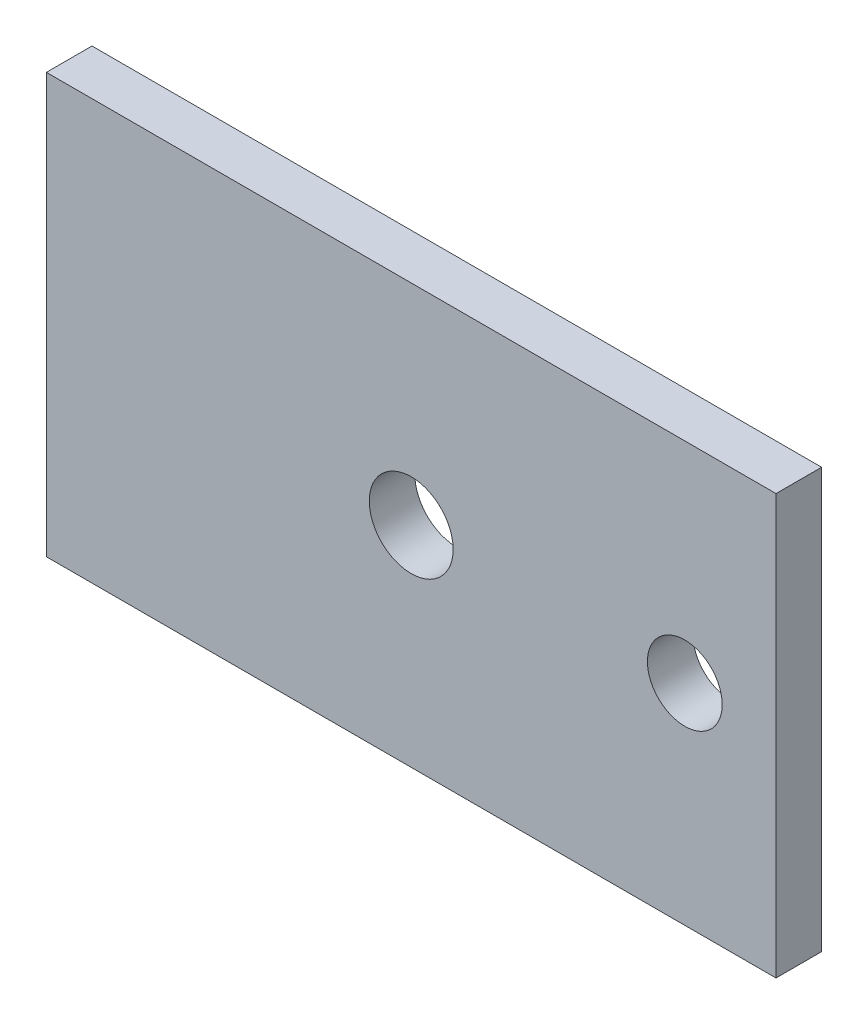
from build123d import *

# Parameters (mm, degrees)
SKETCH1_W           = 80
SKETCH1_H           = 46
SKETCH1_R           = 4.6
SKETCH1_R_2         = 4.1
BOSS_EXTRUDE1_DEPTH = 5


with BuildPart() as part:
    # Sketch1 → Boss-Extrude1 (new body)
    with BuildSketch(Plane.XY):
        Rectangle(SKETCH1_W, SKETCH1_H)
        Circle(SKETCH1_R, mode=Mode.SUBTRACT)
        with Locations((30, 0)):
            Circle(SKETCH1_R_2, mode=Mode.SUBTRACT)
    extrude(amount=BOSS_EXTRUDE1_DEPTH)


solid = part.part
